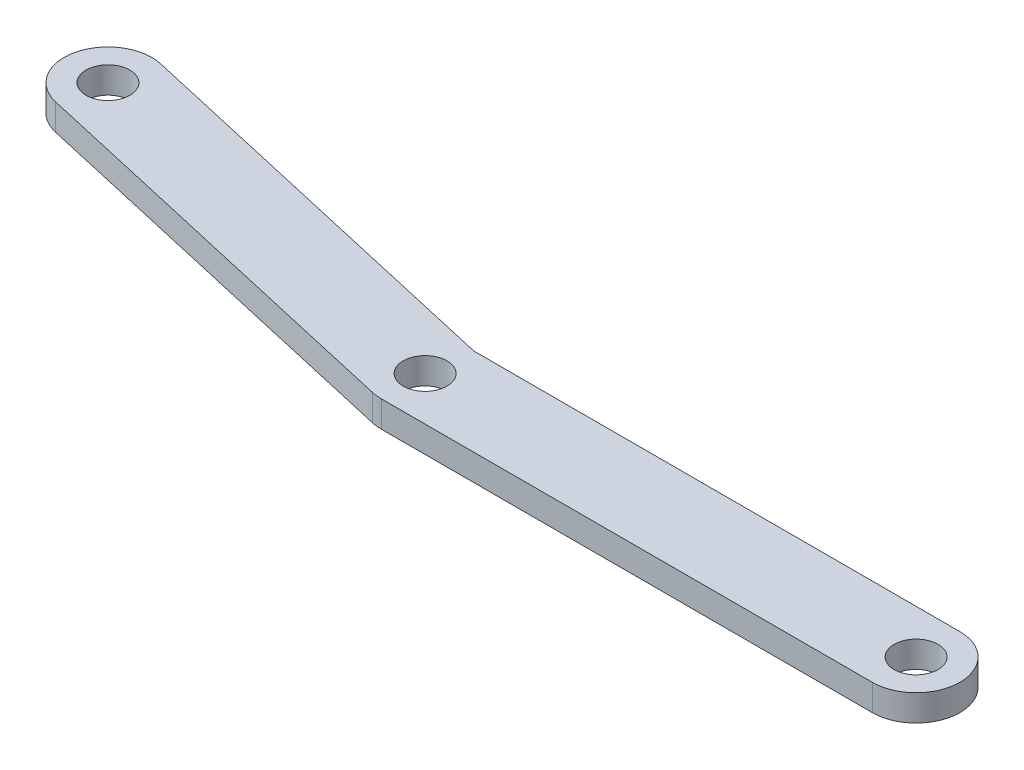
from build123d import *

# Parameters (mm, degrees)
SKETCH2_R               = 3.175
BOSS_EXTRUDE2_DEPTH     = 3.81
SKETCH1_R               = 3.175
BOSS_EXTRUDE3_DEPTH     = 3.81
CUT_EXTRUDE1_DEPTH      = 104.351913602
CUT_EXTRUDE1_DEPTH_BACK = 104.351913602
SKETCH3_R               = 3.175


with BuildPart() as part:
    # Sketch2 → Boss-Extrude2 (new body)
    with BuildSketch(Plane(origin=(0, 0, 0), x_dir=(1, 0, 0), z_dir=(0, 1, 0))):
        with BuildLine():
            Line((-96.411937598, 7.313398015), (-36.96683296, -6.1921984))
            ThreePointArc((-36.96683296, -6.1921984), (-29.3678016, -1.40683296), (-34.15316704, 6.1921984))
            Line((-34.15316704, 6.1921984), (-93.598271679, 19.697794815))
            ThreePointArc((-93.598271679, 19.697794815), (-101.197303038, 14.912429375), (-96.411937598, 7.313398015))
        make_face()
        with Locations((-95.005104638, 13.505596415)):
            Circle(SKETCH2_R, mode=Mode.SUBTRACT)
    extrude(amount=BOSS_EXTRUDE2_DEPTH)

    # Sketch1 → Boss-Extrude3 (add)
    with BuildSketch(Plane(origin=(0, 0, 0), x_dir=(1, 0, 0), z_dir=(0, 1, 0))):
        with BuildLine():
            Line((35.56, 6.35), (-35.56, 6.35))
            ThreePointArc((-35.56, 6.35), (-41.91, 0), (-35.56, -6.35))
            Line((-35.56, -6.35), (35.56, -6.35))
            ThreePointArc((35.56, -6.35), (41.91, 0), (35.56, 6.35))
        make_face()
        with Locations((35.56, 0)):
            Circle(SKETCH1_R, mode=Mode.SUBTRACT)
    extrude(amount=BOSS_EXTRUDE3_DEPTH)

    # Sketch3 → Cut-Extrude1 (cut, two sides: drawn at the far end of the back side and taken through both)
    with BuildSketch(Plane(origin=(0, 3.81, 0), x_dir=(1, 0, 0), z_dir=(0, 1, 0)).offset(-CUT_EXTRUDE1_DEPTH_BACK)):
        with Locations((-35.56, 0)):
            Circle(SKETCH3_R)
    extrude(amount=CUT_EXTRUDE1_DEPTH + CUT_EXTRUDE1_DEPTH_BACK, mode=Mode.SUBTRACT)


solid = part.part
